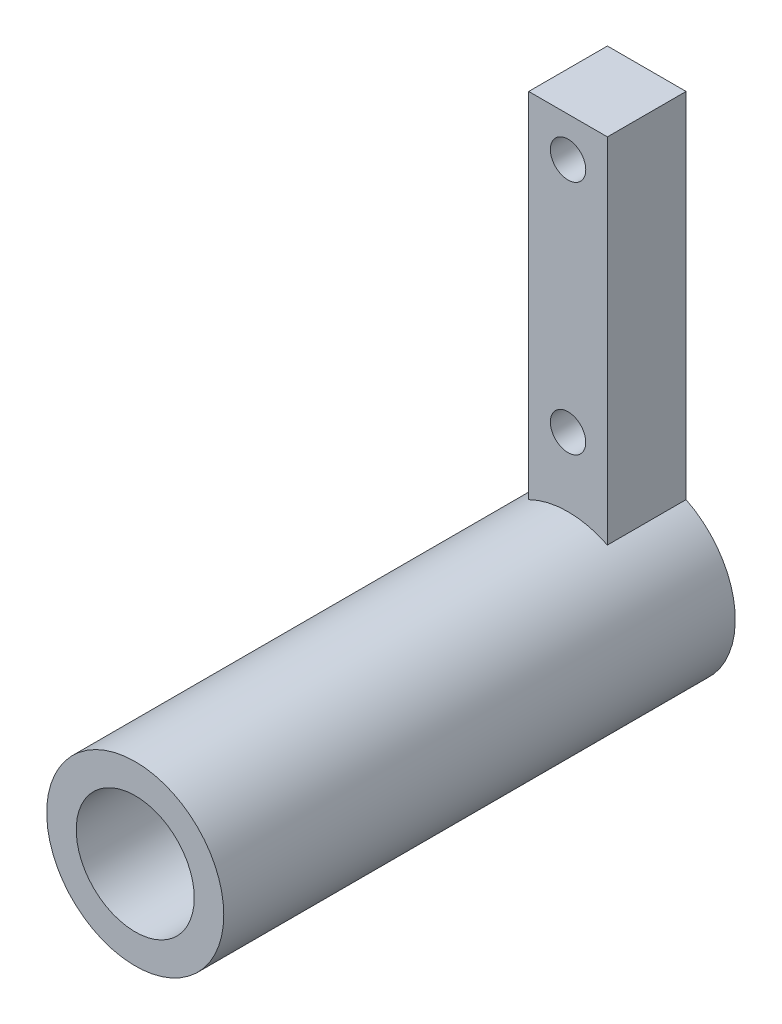
from build123d import *

# Parameters (mm, degrees)
ESQUISSE1_R             = 22.5
BASE_EXTRUSION_DEPTH    = 130
ESQUISSE2_W             = 20
ESQUISSE2_H             = 20
BOSS_EXTRU_1_DEPTH      = 110
ESQUISSE3_R             = 4.5
ENL_V_MAT_EXTRU_1_DEPTH = 20
ESQUISSE4_R             = 15
ENL_V_MAT_EXTRU_2_DEPTH = 120


with BuildPart() as part:
    # Esquisse1 → Base-Extrusion (new body)
    with BuildSketch(Plane.XY):
        Circle(ESQUISSE1_R)
    extrude(amount=BASE_EXTRUSION_DEPTH)

    # Esquisse2 → Boss.-Extru.1 (add)
    with BuildSketch(Plane(origin=(0, 0, 0), x_dir=(1, 0, 0), z_dir=(0, 1, 0))):
        with Locations((0, -10)):
            Rectangle(ESQUISSE2_W, ESQUISSE2_H)
    extrude(amount=BOSS_EXTRU_1_DEPTH)

    # Esquisse3 → Enlèv. mat.-Extru.1 (cut)
    with BuildSketch(Plane.XY.offset(20)):
        with Locations((0, 100)):
            Circle(ESQUISSE3_R)
        with Locations((0, 40)):
            Circle(ESQUISSE3_R)
    extrude(amount=-ENL_V_MAT_EXTRU_1_DEPTH, mode=Mode.SUBTRACT)

    # Esquisse4 → Enlèv. mat.-Extru.2 (cut)
    with BuildSketch(Plane.XY.offset(130)):
        Circle(ESQUISSE4_R)
    extrude(amount=-ENL_V_MAT_EXTRU_2_DEPTH, mode=Mode.SUBTRACT)


solid = part.part
